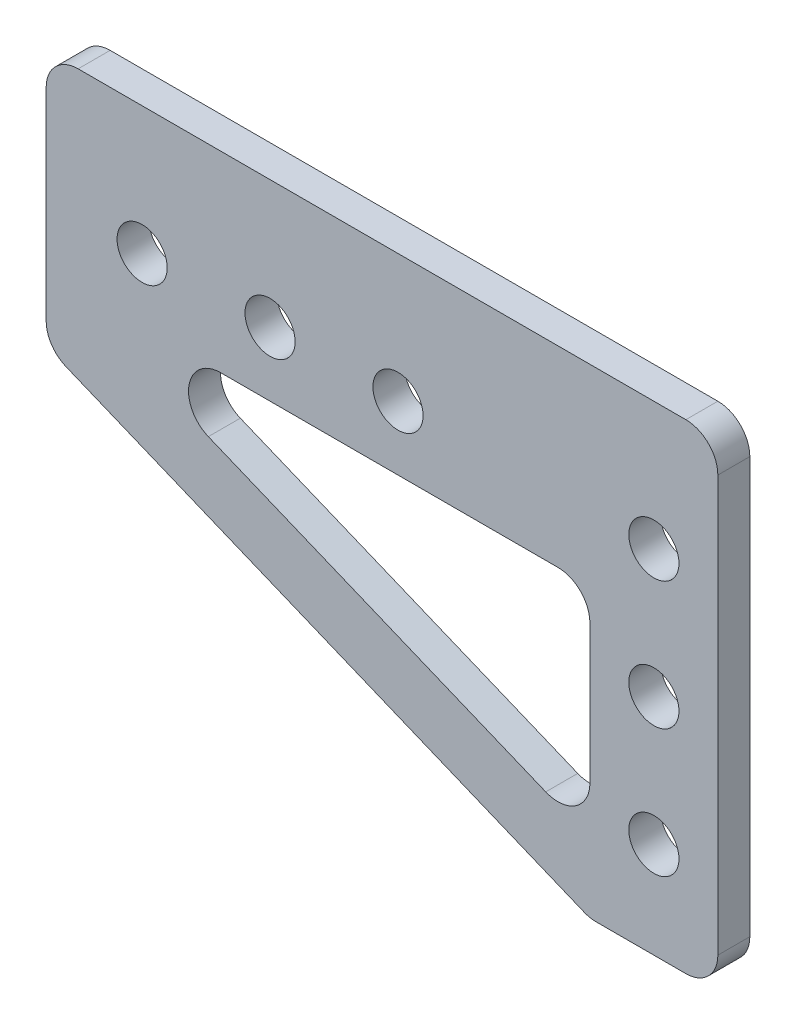
from build123d import *

# Parameters (mm, degrees)
SKETCH1_R           = 2.4892
BOSS_EXTRUDE1_DEPTH = 1.5875
FILLET1_R           = 3.175
FILLET2_R           = 3.175


with BuildPart() as part:
    # Sketch1 → Boss-Extrude1 (new, symmetric)
    with BuildSketch(Plane.XY):
        Polygon((0, 0), (0, -25.4), (53.975, -47.625), (66.675, -47.625), (66.675, 0), align=None)
        with Locations((9.525, -12.7)):
            Circle(SKETCH1_R, mode=Mode.SUBTRACT)
        with Locations((22.225, -12.7)):
            Circle(SKETCH1_R, mode=Mode.SUBTRACT)
        with Locations((34.925, -12.7)):
            Circle(SKETCH1_R, mode=Mode.SUBTRACT)
        with Locations((60.325, -12.7)):
            Circle(SKETCH1_R, mode=Mode.SUBTRACT)
        with Locations((60.325, -25.4)):
            Circle(SKETCH1_R, mode=Mode.SUBTRACT)
        with Locations((60.325, -38.1)):
            Circle(SKETCH1_R, mode=Mode.SUBTRACT)
        with BuildLine():
            Line((16.096832848, -25.160852963), (53.975, -40.757745319))
            Line((53.975, -40.757745319), (53.975, -19.05))
            Line((53.975, -19.05), (17.30571348, -19.05))
            ThreePointArc((17.30571348, -19.05), (14.191074002, -21.608845862), (16.096832848, -25.160852963))
        make_face(mode=Mode.SUBTRACT)
    extrude(amount=BOSS_EXTRUDE1_DEPTH, both=True)

    # Fillet1
    fillet1_edges = [part.edges().sort_by_distance(p)[0] for p in [
        (0, -25.4, 0),
        (0, 0, 0),
        (66.675, 0, 0),
        (66.675, -47.625, 0),
        (53.975, -47.625, 0),
    ]]
    fillet(fillet1_edges, radius=FILLET1_R)

    # Fillet2
    fillet2_edges = [part.edges().sort_by_distance(p)[0] for p in [
        (53.975, -19.05, 0),
        (53.975, -40.757745319, 0),
    ]]
    fillet(fillet2_edges, radius=FILLET2_R)


solid = part.part
